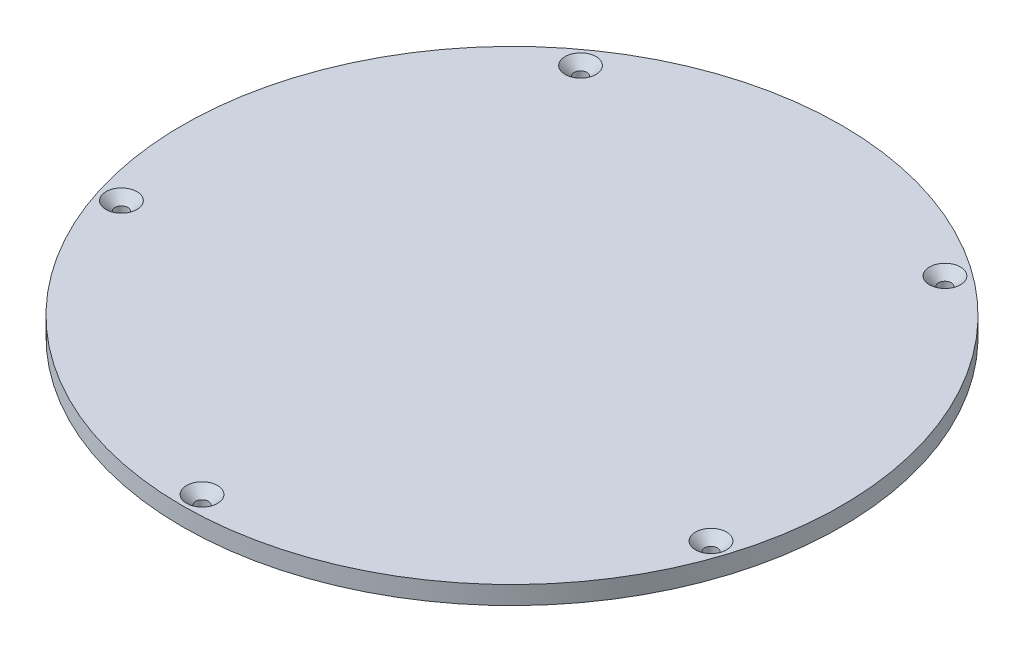
from build123d import *

# Parameters (mm, degrees)
SKETCH1_R           = 72.3
SKETCH1_R_2         = 1.4
BOSS_EXTRUDE1_DEPTH = 4
CHAMFER1_SIZE       = 2


# Read off the part's stored shape, not the designer's step: CirPattern4
with BuildPart() as part:
    # Sketch1 → Boss-Extrude1 (new body)
    with BuildSketch(Plane(origin=(0, 0, 0), x_dir=(-1, 0, 0), z_dir=(0, 1, 0))):
        with Locations(Location((28.500199727, 0, 0), (0, 0, 90))):
            Circle(SKETCH1_R)
        with Locations(Location((28.500199727, 68, 0), (0, 0, 90))):
            Circle(SKETCH1_R_2, mode=Mode.SUBTRACT)
    extrude(amount=BOSS_EXTRUDE1_DEPTH)

    # Chamfer1
    chamfer1_edges = [part.edges().sort_by_distance(p)[0] for p in [
        (-28.500199727, 4, 66.6),
    ]]
    chamfer(chamfer1_edges, length=CHAMFER1_SIZE)

    # CirPattern4 outline → CirPattern4 (revolve, cut)
    with BuildSketch(Plane(origin=(-93.172042835, 0, 21.013155617), x_dir=(1, 0, 0), z_dir=(0, 0, 1))):
        Polygon((3.4, 4), (0, 4), (0, 0), (1.4, 0), (1.4, 2), align=None)
    revolve(axis=Axis((-93.172042835, 0, 21.013155617), (0, 1, 0)), mode=Mode.SUBTRACT)

    # CirPattern4 2 outline → CirPattern4 2 (revolve, cut)
    with BuildSketch(Plane(origin=(-68.469596883, 0, -55.013155617), x_dir=(1, 0, 0), z_dir=(0, 0, 1))):
        Polygon((3.4, 4), (0, 4), (0, 0), (1.4, 0), (1.4, 2), align=None)
    revolve(axis=Axis((-68.469596883, 0, -55.013155617), (0, 1, 0)), mode=Mode.SUBTRACT)

    # CirPattern4 3 outline → CirPattern4 3 (revolve, cut)
    with BuildSketch(Plane(origin=(11.469197429, 0, -55.013155617), x_dir=(1, 0, 0), z_dir=(0, 0, 1))):
        Polygon((3.4, 4), (0, 4), (0, 0), (1.4, 0), (1.4, 2), align=None)
    revolve(axis=Axis((11.469197429, 0, -55.013155617), (0, 1, 0)), mode=Mode.SUBTRACT)

    # CirPattern4 4 outline → CirPattern4 4 (revolve, cut)
    with BuildSketch(Plane(origin=(36.171643381, 0, 21.013155617), x_dir=(1, 0, 0), z_dir=(0, 0, 1))):
        Polygon((3.4, 4), (0, 4), (0, 0), (1.4, 0), (1.4, 2), align=None)
    revolve(axis=Axis((36.171643381, 0, 21.013155617), (0, 1, 0)), mode=Mode.SUBTRACT)


solid = part.part
